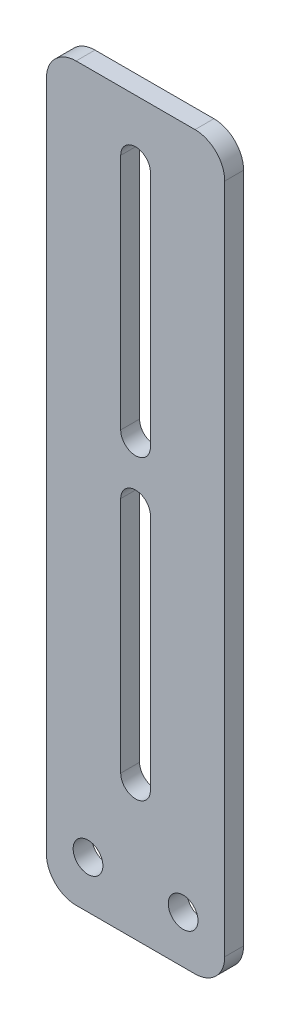
from build123d import *

# Parameters (mm, degrees)
SKETCH1_W           = 30
SKETCH1_H           = 123
SKETCH1_R           = 2.5
BOSS_EXTRUDE1_DEPTH = 3.175
FILLET2_R           = 5


with BuildPart() as part:
    # Sketch1 → Boss-Extrude1 (new body)
    with BuildSketch(Plane.XY):
        with Locations((0, 61.5)):
            Rectangle(SKETCH1_W, SKETCH1_H)
        with Locations((-8, 8)):
            Circle(SKETCH1_R, mode=Mode.SUBTRACT)
        with Locations((8, 8)):
            Circle(SKETCH1_R, mode=Mode.SUBTRACT)
        with BuildLine():
            Line((2.5, 113), (2.5, 73))
            ThreePointArc((2.5, 73), (0, 70.5), (-2.5, 73))
            Line((-2.5, 73), (-2.5, 113))
            ThreePointArc((-2.5, 113), (0, 115.5), (2.5, 113))
        make_face(mode=Mode.SUBTRACT)
        with BuildLine():
            Line((-2.5, 63), (-2.5, 23))
            ThreePointArc((-2.5, 23), (0, 20.5), (2.5, 23))
            Line((2.5, 23), (2.5, 63))
            ThreePointArc((2.5, 63), (0, 65.5), (-2.5, 63))
        make_face(mode=Mode.SUBTRACT)
    extrude(amount=BOSS_EXTRUDE1_DEPTH)

    # Fillet2
    fillet2_edges = [part.edges().sort_by_distance(p)[0] for p in [
        (15, 0, 1.5875),
        (-15, 0, 1.5875),
        (15, 123, 1.5875),
        (-15, 123, 1.5875),
    ]]
    fillet(fillet2_edges, radius=FILLET2_R)


solid = part.part
